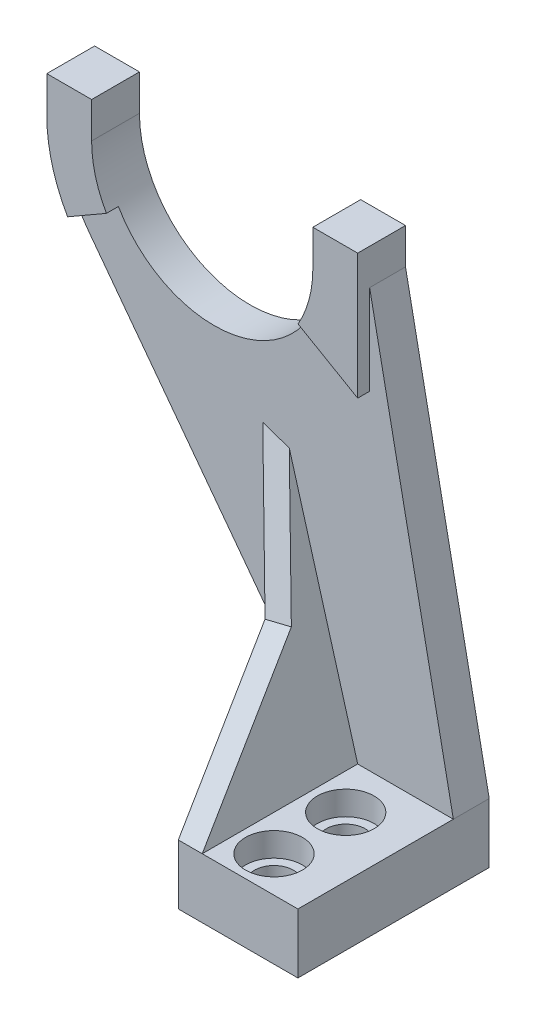
from build123d import *

# Parameters (mm, degrees)
BOSS_EXTRUDE1_DEPTH = 9.525
RIB1_REACH          = 156.901
SKETCH3_WALL_W      = 425.12827586
SKETCH3_WALL_H      = 9.525
BOSS_EXTRUDE2_DEPTH = 12.7
SKETCH4_W           = 31.75
SKETCH4_H           = 15.875
BOSS_EXTRUDE3_DEPTH = 41.275
SKETCH10_W          = 41.275
SKETCH10_H          = 68.618379108
BOSS_EXTRUDE4_DEPTH = 6.35
CUT_EXTRUDE5_DEPTH  = 173.025545539
SKETCH14_R          = 7.540625
CUT_EXTRUDE6_DEPTH  = 6.35
SKETCH15_R          = 5.159375
CUT_EXTRUDE7_DEPTH  = 156.055766211


with BuildPart() as part:
    # Sketch1 → Boss-Extrude1 (new body)
    with BuildSketch(Plane.XY):
        with BuildLine():
            Line((0, 15.875), (0, 0))
            Line((0, 0), (31.75, 0))
            Line((31.75, 0), (31.75, 15.875))
            Line((31.75, 15.875), (9.525, 15.875))
            Line((9.525, 15.875), (9.525, 136.525))
            Line((9.525, 136.525), (-2.38125, 136.525))
            Line((-2.38125, 136.525), (-2.38125, 127))
            ThreePointArc((-2.38125, 127), (-31.75, 97.63125), (-61.11875, 127))
            Line((-61.11875, 127), (-61.11875, 136.525))
            Line((-61.11875, 136.525), (-73.025, 136.525))
            Line((-73.025, 136.525), (-73.025, 127))
            ThreePointArc((-73.025, 127), (-70.906903127, 113.947698958), (-64.77, 102.235))
            Line((-64.77, 102.235), (0, 15.875))
        make_face()
    extrude(amount=BOSS_EXTRUDE1_DEPTH)

    # Sketch3 wall → Rib1 (add, up to next)
    with BuildSketch(Plane(origin=(20.6375, 71.4375, 4.7625), x_dir=(-0.196116135138, 0.980580675691, 0), z_dir=(-0.980580675691, -0.196116135138, 0)), mode=Mode.PRIVATE) as rib1_sk1:
        Rectangle(SKETCH3_WALL_W, SKETCH3_WALL_H)
    rib1_tool1 = extrude(rib1_sk1.sketch, amount=RIB1_REACH, mode=Mode.PRIVATE) - part.part
    add(rib1_tool1.solids().sort_by_distance((20.6375, 71.4375, 4.7625))[0])

    # Sketch1<3> → Boss-Extrude2 (add)
    with BuildSketch(Plane.XY):
        with BuildLine():
            ThreePointArc((-73.025, 127), (-71.61858848, 116.317243913), (-67.495198541, 106.3625))
            Line((-67.495198541, 106.3625), (-57.184083577, 112.315625))
            ThreePointArc((-57.184083577, 112.315625), (-60.118034111, 119.398808169), (-61.11875, 127))
            Line((-61.11875, 127), (-61.11875, 136.525))
            Line((-61.11875, 136.525), (-73.025, 136.525))
            Line((-73.025, 136.525), (-73.025, 127))
        make_face()
        with BuildLine():
            Line((-6.315916423, 112.315625), (9.525, 103.169867639))
            Line((9.525, 103.169867639), (9.525, 136.525))
            Line((9.525, 136.525), (-2.38125, 136.525))
            Line((-2.38125, 136.525), (-2.38125, 127))
            ThreePointArc((-2.38125, 127), (-3.381965889, 119.398808169), (-6.315916423, 112.315625))
        make_face()
    extrude(amount=BOSS_EXTRUDE2_DEPTH)

    # Sketch4 → Boss-Extrude3 (add)
    with BuildSketch(Plane.XY.offset(9.525)):
        with Locations((15.875, 7.9375)):
            Rectangle(SKETCH4_W, SKETCH4_H)
    extrude(amount=BOSS_EXTRUDE3_DEPTH)

    # Sketch10 → Boss-Extrude4 (add, along a direction that is not the sketch's normal)
    with BuildSketch(Plane(origin=(4.193396226, 1.198113208, 0), x_dir=(0, 0, -1), z_dir=(0.9615239476408233, 0.2747211278973781, 0))):
        with Locations((-30.1625, 49.573382223)):
            Rectangle(SKETCH10_W, SKETCH10_H)
    extrude(amount=BOSS_EXTRUDE4_DEPTH, dir=(1, 0, 0))

    # Sketch11 → Cut-Extrude5 (cut, through all, along a direction that is not the sketch's normal)
    with BuildSketch(Plane(origin=(10.064150943, 2.875471698, 0), x_dir=(0, 0, -1), z_dir=(0.9615239476408232, 0.27472112789737807, 0))):
        Polygon((-50.8, 82.138092614), (-50.8, 13.519713507), (-19.05, 45.269713507), (-9.525, 54.794713507), (-9.525, 82.138092614), align=None)
    extrude(amount=-CUT_EXTRUDE5_DEPTH, dir=(1, 0, 0), mode=Mode.SUBTRACT)

    # Sketch13 → Loft2 section 0
    with BuildSketch(Plane(origin=(10.064150943, 2.875471698, 0), x_dir=(0, 0, -1), z_dir=(0.9615239476408232, 0.27472112789737807, 0))):
        with BuildLine():
            Line((-18.177760419, 46.141953088), (-8.652760419, 83.010332195))
            Line((-8.652760419, 83.010332195), (-9.525, 54.794713507))
            Line((-9.525, 54.794713507), (-18.177760419, 46.141953088))
        make_face()
    # Sketch12 → Loft2 section 1
    with BuildSketch(Plane(origin=(4.193396226, 1.198113208, 0), x_dir=(0, 0, -1), z_dir=(0.9615239476408233, 0.2747211278973781, 0))):
        with BuildLine():
            Line((-19.05, 47.014192669), (-9.525, 83.882571777))
            Line((-9.525, 83.882571777), (-9.525, 56.539192669))
            Line((-9.525, 56.539192669), (-19.05, 47.014192669))
        make_face()
    loft()

    # Sketch14 → Cut-Extrude6 (cut)
    with BuildSketch(Plane(origin=(0, 15.875, 0), x_dir=(1, 0, 0), z_dir=(0, 1, 0))):
        with Locations((15.875, -41.275)):
            Circle(SKETCH14_R)
        with Locations((15.875, -22.225)):
            Circle(SKETCH14_R)
    extrude(amount=-CUT_EXTRUDE6_DEPTH, mode=Mode.SUBTRACT)

    # Sketch15 → Cut-Extrude7 (cut, through all)
    with BuildSketch(Plane(origin=(0, 9.525, 0), x_dir=(1, 0, 0), z_dir=(0, 1, 0))):
        with Locations((15.875, -22.225)):
            Circle(SKETCH15_R)
        with Locations((15.875, -41.275)):
            Circle(SKETCH15_R)
    extrude(amount=-CUT_EXTRUDE7_DEPTH, mode=Mode.SUBTRACT)


solid = part.part
